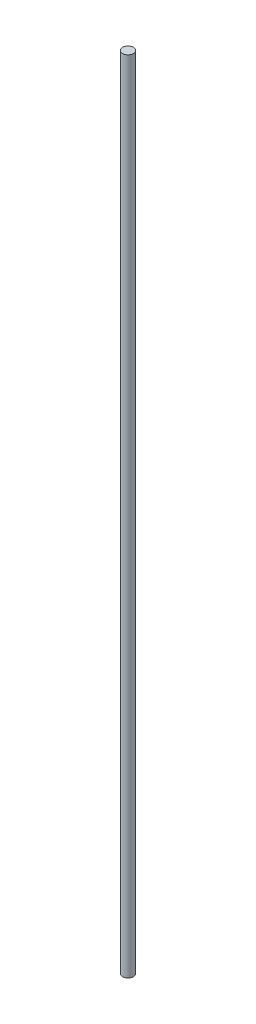
from build123d import *

# Parameters (mm, degrees)
SKETCH1_R           = 6.35
BOSS_EXTRUDE1_DEPTH = 934.4


with BuildPart() as part:
    # Sketch1 → Boss-Extrude1 (new body)
    with BuildSketch(Plane(origin=(0, 0, 0), x_dir=(1, 0, 0), z_dir=(0, 1, 0))):
        Circle(SKETCH1_R)
    extrude(amount=BOSS_EXTRUDE1_DEPTH)


solid = part.part
